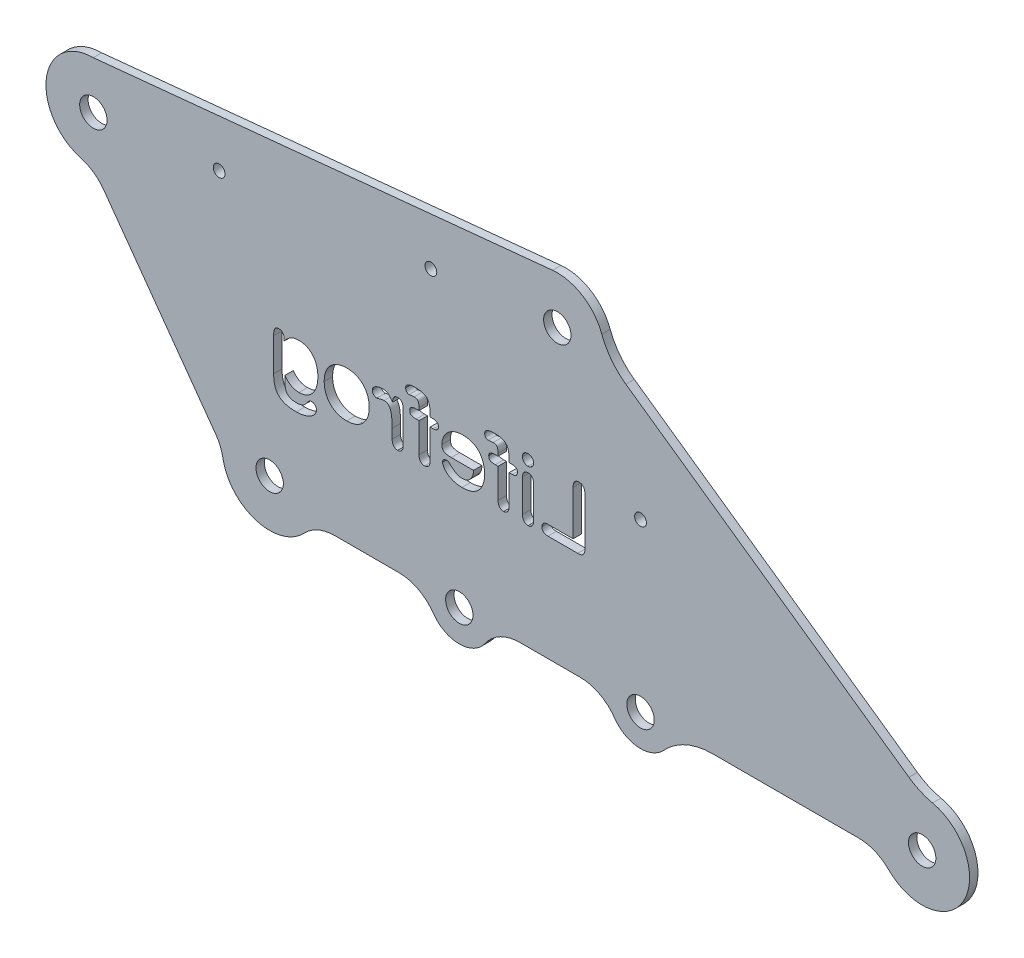
from build123d import *

# Parameters (mm, degrees)
SKETCH2_R           = 3.25
BOSS_EXTRUDE1_DEPTH = 2
SKETCH7_R           = 1.4
CUT_EXTRUDE4_DEPTH  = 170.227847288
CUT_EXTRUDE5_DEPTH  = 170.227847288
SKETCH9_R           = 4.424451358
SKETCH9_R_2         = 3.80051452
CUT_EXTRUDE6_DEPTH  = 10


with BuildPart() as part:
    # Sketch2 → Boss-Extrude1 (new body)
    with BuildSketch(Plane.XY):
        with BuildLine():
            Line((-146.482261324, -3.415116213), (-119.900209046, -40.345357838))
            ThreePointArc((-119.900209046, -40.345357838), (-118.800607084, -42.305283789), (-118.166440512, -44.46126778))
            ThreePointArc((-118.166440512, -44.46126778), (-110.313224995, -53.296457195), (-98.896144571, -50.233151699))
            ThreePointArc((-98.896144571, -50.233151699), (-95.581387, -47.909162096), (-91.616909182, -47.089734824))
            Line((-91.616909182, -47.089734824), (-76.446691, -47.089734824))
            ThreePointArc((-76.446691, -47.089734824), (-71.817590501, -48.22568222), (-68.240172934, -51.37544911))
            ThreePointArc((-68.240172934, -51.37544911), (-62.085284384, -54.589734824), (-55.930395834, -51.37544911))
            ThreePointArc((-55.930395834, -51.37544911), (-52.352978266, -48.22568222), (-47.723877768, -47.089734824))
            Line((-47.723877768, -47.089734824), (-33.446691, -47.089734824))
            ThreePointArc((-33.446691, -47.089734824), (-28.817590501, -48.22568222), (-25.240172934, -51.37544911))
            ThreePointArc((-25.240172934, -51.37544911), (-19.593639667, -54.572486651), (-13.566591065, -52.168516573))
            ThreePointArc((-13.566591065, -52.168516573), (-8.311100334, -48.415273127), (-1.990501675, -47.089734824))
            Line((-1.990501675, -47.089734824), (32.686636747, -47.089734824))
            ThreePointArc((32.686636747, -47.089734824), (36.521461692, -47.854253372), (39.769927676, -50.030911295))
            ThreePointArc((39.769927676, -50.030911295), (57.590414229, -47.521571248), (50.200722675, -31.112458317))
            ThreePointArc((50.200722675, -31.112458317), (47.278407153, -30.14859154), (44.599620096, -28.63430389))
            Line((44.599620096, -28.63430389), (-22.564700668, 18.554547573))
            ThreePointArc((-22.564700668, 18.554547573), (-25.986792869, 21.830620173), (-28.278442139, 25.976908916))
            ThreePointArc((-28.278442139, 25.976908916), (-32.864492812, 31.616465892), (-39.941717654, 33.27458296))
            Line((-39.941717654, 33.27458296), (-148.918739614, 22.469864413))
            ThreePointArc((-148.918739614, 22.469864413), (-160.065949313, 12.737169894), (-151.925623591, 0.379147243))
            ThreePointArc((-151.925623591, 0.379147243), (-148.880072017, -1.053350399), (-146.482261324, -3.415116213))
        make_face()
        with Locations((47.738629971, -42.089734824)):
            Circle(SKETCH2_R, mode=Mode.SUBTRACT)
        with Locations((-19.085284384, -47.089734824)):
            Circle(SKETCH2_R, mode=Mode.SUBTRACT)
        with Locations((-62.085284384, -47.089734824)):
            Circle(SKETCH2_R, mode=Mode.SUBTRACT)
        with Locations((-107.085284384, -42.519495684)):
            Circle(SKETCH2_R, mode=Mode.SUBTRACT)
        with Locations((-148.918739614, 11.219864413)):
            Circle(SKETCH2_R, mode=Mode.SUBTRACT)
        with Locations((-38.831758764, 22.07947281)):
            Circle(SKETCH2_R, mode=Mode.SUBTRACT)
    extrude(amount=BOSS_EXTRUDE1_DEPTH)

    # Sketch7 → Cut-Extrude4 (cut, through all)
    with BuildSketch(Plane.XY.offset(2)):
        with Locations((-119.063647537, 14.164941171)):
            Circle(SKETCH7_R)
        with Locations((-68.831758764, 19.120101507)):
            Circle(SKETCH7_R)
        with Locations((-19.085284384, -7.519495684)):
            Circle(SKETCH7_R)
    extrude(amount=-CUT_EXTRUDE4_DEPTH, mode=Mode.SUBTRACT)

    # Sketch8 → Cut-Extrude5 (cut, through all)
    # profile 1 of 9: a face of its own
    with BuildSketch(Plane(origin=(0, 0, 0), x_dir=(-1, 0, 0), z_dir=(0, 0, -1))):
        with BuildLine():
            Line((35.086320726, -8.88917677), (35.086320726, -19.477067395))
            Line((35.086320726, -19.477067395), (41.039445726, -19.477067395))
            add(Edge.make_bspline(
                [(41.039445726, -19.477067395), (41.151207657, -19.479993195), (41.364330782, -19.485572515), (41.662298188, -19.554542719), (41.923339942, -19.661257744), (42.134401002, -19.819951832), (42.304522289, -20.005566477), (42.428077526, -20.217869304), (42.500347045, -20.454899643), (42.50877144, -20.620129964), (42.513078539, -20.704606457)],
                knots=[0, 0, 0, 0, 1.240270116, 2.365118784, 3.381765818, 4.352609133, 5.275186246, 6.165500839, 7.062084633, 8, 8, 8, 8], degree=3))
            add(Edge.make_bspline(
                [(42.513078539, -20.704606457), (42.508946769, -20.791061883), (42.500954328, -20.958300126), (42.427991131, -21.197153566), (42.305901504, -21.407864411), (42.137936653, -21.589554136), (41.927138947, -21.739731647), (41.667288952, -21.839448431), (41.367976859, -21.905877279), (41.153144472, -21.911559901), (41.039445726, -21.914567395)],
                knots=[0, 0, 0, 0, 0.961785517, 1.860465312, 2.752861249, 3.654173772, 4.599371787, 5.609990076, 6.735101654, 8, 8, 8, 8], degree=3))
            Line((41.039445726, -21.914567395), (33.996476976, -21.914567395))
            add(Edge.make_bspline(
                [(33.996476976, -21.914567395), (33.853353838, -21.910822677), (33.586803908, -21.903848583), (33.219164265, -21.820051925), (32.910084712, -21.691568649), (32.663815683, -21.496286799), (32.482305295, -21.2361672), (32.358100514, -20.915092293), (32.287886266, -20.530846545), (32.278723904, -20.25471837), (32.273820726, -20.106950207)],
                knots=[0, 0, 0, 0, 1.184943227, 2.206816713, 3.109923682, 3.939837529, 4.776053014, 5.71019795, 6.774627611, 8, 8, 8, 8], degree=3))
            Line((32.273820726, -20.106950207), (32.273820726, -8.88917677))
            add(Edge.make_bspline(
                [(32.273820726, -8.88917677), (32.277444522, -8.749162056), (32.284268854, -8.485486372), (32.356957437, -8.118037422), (32.476634418, -7.804802622), (32.645141816, -7.546892469), (32.856855173, -7.348035389), (33.099081612, -7.202614303), (33.373976884, -7.118889739), (33.566226734, -7.107793002), (33.665422289, -7.102067395)],
                knots=[0, 0, 0, 0, 1.312227502, 2.471186598, 3.495416453, 4.440711492, 5.33513045, 6.197779038, 7.0701043, 8, 8, 8, 8], degree=3))
            add(Edge.make_bspline(
                [(33.665422289, -7.102067395), (33.766728298, -7.106162598), (33.963485083, -7.114116312), (34.241681246, -7.204196573), (34.491196095, -7.34317393), (34.705487503, -7.541754535), (34.882515406, -7.795771782), (35.002902616, -8.111096688), (35.076257378, -8.481501141), (35.082815622, -8.747181708), (35.086320726, -8.88917677)],
                knots=[0, 0, 0, 0, 0.937651975, 1.821110013, 2.686129292, 3.571911612, 4.510265029, 5.535848738, 6.683015045, 8, 8, 8, 8], degree=3))
        make_face()
    # profile 2 of 9: a face of its own
    with BuildSketch(Plane(origin=(0, 0, 0), x_dir=(-1, 0, 0), z_dir=(0, 0, -1))):
        with BuildLine():
            Line((47.086320726, -12.74464552), (47.086320726, -20.476090832))
            add(Edge.make_bspline(
                [(47.086320726, -20.476090832), (47.082420593, -20.602435528), (47.075064066, -20.84074997), (47.005182236, -21.174236118), (46.88809835, -21.460321774), (46.722706311, -21.694972614), (46.519526295, -21.876468441), (46.28964053, -22.009165841), (46.031653529, -22.087195916), (45.85149376, -22.097028675), (45.759172289, -22.102067395)],
                knots=[0, 0, 0, 0, 1.279660949, 2.41372764, 3.434282009, 4.393028164, 5.297478756, 6.175532382, 7.06506577, 8, 8, 8, 8], degree=3))
            add(Edge.make_bspline(
                [(45.759172289, -22.102067395), (45.666704772, -22.097531408), (45.487838174, -22.08875712), (45.23365211, -22.004912745), (45.006451484, -21.871389965), (44.811013414, -21.682373157), (44.650959039, -21.445866625), (44.541087672, -21.160395096), (44.473171135, -20.832780478), (44.465421067, -20.599508451), (44.461320726, -20.476090832)],
                knots=[0, 0, 0, 0, 0.944656094, 1.82731652, 2.710883517, 3.62364324, 4.589202842, 5.612771424, 6.736985008, 8, 8, 8, 8], degree=3))
            Line((44.461320726, -20.476090832), (44.461320726, -12.823747082))
            add(Edge.make_bspline(
                [(44.461320726, -12.823747082), (44.4655151, -12.699382119), (44.473445887, -12.464230884), (44.539697696, -12.136087305), (44.650415089, -11.854229206), (44.811202223, -11.625466775), (45.007817757, -11.44586487), (45.234070933, -11.317596829), (45.488859368, -11.241954113), (45.666855774, -11.232151465), (45.759172289, -11.227067395)],
                knots=[0, 0, 0, 0, 1.282601348, 2.425162879, 3.437763456, 4.38569495, 5.284727511, 6.164859808, 7.048218153, 8, 8, 8, 8], degree=3))
            add(Edge.make_bspline(
                [(45.759172289, -11.227067395), (45.851434596, -11.232364163), (46.031201162, -11.242684541), (46.289294531, -11.316791228), (46.519597684, -11.446472242), (46.719799732, -11.624386887), (46.886864263, -11.846010703), (47.003355814, -12.112795725), (47.074726656, -12.416719887), (47.082335115, -12.631916842), (47.086320726, -12.74464552)],
                knots=[0, 0, 0, 0, 0.975882645, 1.901438153, 2.812865763, 3.75006033, 4.717368935, 5.725761173, 6.808663735, 8, 8, 8, 8], degree=3))
        make_face()
    # profile 3 of 9: a face of its own
    with BuildSketch(Plane(origin=(0, 0, 0), x_dir=(-1, 0, 0), z_dir=(0, 0, -1))):
        with BuildLine():
            add(Edge.make_bspline(
                [(45.788469164, -9.914567395), (45.700155278, -9.911112501), (45.527837589, -9.904371326), (45.279123369, -9.837014704), (45.05142568, -9.726888524), (44.844494731, -9.578448802), (44.672494362, -9.386651845), (44.546452039, -9.154497095), (44.472722475, -8.885778489), (44.46522284, -8.695310105), (44.461320726, -8.59620802)],
                knots=[0, 0, 0, 0, 1.006201835, 1.963296869, 2.915511555, 3.880878732, 4.85189213, 5.829536295, 6.870691953, 8, 8, 8, 8], degree=3))
            add(Edge.make_bspline(
                [(44.461320726, -8.59620802), (44.466503012, -8.504891338), (44.476546269, -8.327919822), (44.551669892, -8.073896193), (44.680826892, -7.848246813), (44.854448523, -7.652100465), (45.060826482, -7.494003153), (45.286053439, -7.371969471), (45.53257688, -7.303278473), (45.702130039, -7.29419357), (45.788469164, -7.289567395)],
                knots=[0, 0, 0, 0, 1.057408726, 2.04925565, 3.037480321, 4.047814229, 5.064214746, 6.036169889, 6.999986943, 8, 8, 8, 8], degree=3))
            add(Edge.make_bspline(
                [(45.788469164, -7.289567395), (45.871883282, -7.293289281), (46.035245133, -7.300578386), (46.272968232, -7.365176401), (46.494233713, -7.471719022), (46.696092474, -7.61868617), (46.874547315, -7.801949122), (46.996351464, -8.035133325), (47.076989401, -8.302838261), (47.083100242, -8.494958443), (47.086320726, -8.59620802)],
                knots=[0, 0, 0, 0, 0.967133894, 1.894077239, 2.837452275, 3.803721558, 4.782485793, 5.777084342, 6.828497526, 8, 8, 8, 8], degree=3))
            add(Edge.make_bspline(
                [(47.086320726, -8.59620802), (47.082548229, -8.694407685), (47.075299369, -8.883098506), (46.999769728, -9.148438196), (46.878868744, -9.381879948), (46.705206821, -9.571319036), (46.504492812, -9.722899361), (46.282136483, -9.833786351), (46.041845864, -9.904963009), (45.873933033, -9.911327839), (45.788469164, -9.914567395)],
                knots=[0, 0, 0, 0, 1.133982342, 2.178948973, 3.165031597, 4.149752721, 5.126395816, 6.06160272, 7.013399203, 8, 8, 8, 8], degree=3))
        make_face()
    # profile 4 of 9: a face of its own
    with BuildSketch(Plane(origin=(0, 0, 0), x_dir=(-1, 0, 0), z_dir=(0, 0, -1))):
        with BuildLine():
            Line((49.632219164, -11.414567395), (50.273820726, -11.414567395))
            Line((50.273820726, -11.414567395), (50.273820726, -10.591325207))
            add(Edge.make_bspline(
                [(50.273820726, -10.591325207), (50.277514056, -10.388045332), (50.284509589, -10.00301306), (50.342549558, -9.457909943), (50.436641901, -8.978381027), (50.569332837, -8.557808501), (50.755633772, -8.195572563), (50.996610195, -7.887535194), (51.293777818, -7.633608774), (51.648730133, -7.431434885), (52.067068931, -7.280410479), (52.552532894, -7.174729198), (53.108091552, -7.111487828), (53.502156344, -7.105323868), (53.710344164, -7.102067395)],
                knots=[0, 0, 0, 0, 1.272338929, 2.409936283, 3.426662608, 4.327577154, 5.161578725, 5.96266415, 6.760383261, 7.592994418, 8.506024445, 9.533847079, 10.697110196, 12, 12, 12, 12], degree=3))
            add(Edge.make_bspline(
                [(53.710344164, -7.102067395), (53.895146779, -7.104261268), (54.241413904, -7.108371958), (54.723647309, -7.168286024), (55.135762658, -7.255167266), (55.473032061, -7.391161667), (55.744889456, -7.558653085), (55.937764712, -7.776533401), (56.05427242, -8.037027657), (56.067659952, -8.223910447), (56.074601976, -8.320817395)],
                knots=[0, 0, 0, 0, 1.495564663, 2.802259462, 3.930374803, 4.895312065, 5.735498063, 6.492167842, 7.218122695, 8, 8, 8, 8], degree=3))
            add(Edge.make_bspline(
                [(56.074601976, -8.320817395), (56.07205453, -8.384563693), (56.067042815, -8.509974928), (56.019565864, -8.690669099), (55.937272087, -8.855101057), (55.831089458, -9.002344218), (55.703605103, -9.125761707), (55.560931421, -9.215318606), (55.405925119, -9.272564588), (55.297752865, -9.278650351), (55.242570726, -9.281754895)],
                knots=[0, 0, 0, 0, 1.08569999, 2.135951137, 3.156332465, 4.20565892, 5.218674748, 6.161348951, 7.062045096, 8, 8, 8, 8], degree=3))
            add(Edge.make_bspline(
                [(55.242570726, -9.281754895), (55.211291096, -9.281243662), (55.139763808, -9.280074624), (55.017892004, -9.265550853), (54.867145158, -9.249871502), (54.639618335, -9.213428957), (54.363834674, -9.175272517), (54.14601204, -9.167906783), (54.047258226, -9.164567395)],
                knots=[0, 0, 0, 0, 0.468218035, 1.070676523, 1.83620524, 2.737967929, 4.521099009, 6, 6, 6, 6], degree=3))
            add(Edge.make_bspline(
                [(54.047258226, -9.164567395), (53.935335203, -9.168513751), (53.730509601, -9.175735811), (53.453388449, -9.253609551), (53.236438618, -9.387787922), (53.093840565, -9.587280743), (53.00705741, -9.82836939), (52.94477266, -10.108223991), (52.902635068, -10.432859402), (52.900145328, -10.66441903), (52.898820726, -10.78761427)],
                knots=[0, 0, 0, 0, 1.158634456, 2.120368021, 2.955008234, 3.751380872, 4.611223429, 5.599229928, 6.722733105, 8, 8, 8, 8], degree=3))
            Line((52.898820726, -10.78761427), (52.898820726, -11.414567395))
            Line((52.898820726, -11.414567395), (53.563859789, -11.414567395))
            add(Edge.make_bspline(
                [(53.563859789, -11.414567395), (53.684179087, -11.416649074), (53.910242779, -11.420560268), (54.225792592, -11.467875581), (54.49621768, -11.540251074), (54.718209635, -11.648680399), (54.893566863, -11.789413733), (55.016660753, -11.965226471), (55.094330745, -12.172143548), (55.10125483, -12.32106946), (55.104875414, -12.398942395)],
                knots=[0, 0, 0, 0, 1.396050608, 2.622990337, 3.6962846, 4.634546857, 5.472373731, 6.277878481, 7.09950757, 8, 8, 8, 8], degree=3))
            add(Edge.make_bspline(
                [(55.104875414, -12.398942395), (55.100784732, -12.506003658), (55.0933337, -12.701011923), (55.017531846, -12.965095468), (54.888175636, -13.171513058), (54.692271136, -13.302589493), (54.461307669, -13.37783369), (54.196374468, -13.437731598), (53.892808985, -13.470942071), (53.677213775, -13.474956644), (53.563859789, -13.477067395)],
                knots=[0, 0, 0, 0, 1.171181197, 2.133264703, 2.982673099, 3.781862637, 4.659228062, 5.636037739, 6.757094158, 8, 8, 8, 8], degree=3))
            Line((53.563859789, -13.477067395), (52.898820726, -13.477067395))
            Line((52.898820726, -13.477067395), (52.898820726, -20.49073927))
            add(Edge.make_bspline(
                [(52.898820726, -20.49073927), (52.894890647, -20.614179922), (52.887425469, -20.848655192), (52.816934516, -21.176561155), (52.703366177, -21.461585314), (52.538062875, -21.695052259), (52.335369862, -21.875428653), (52.106713482, -22.010618694), (51.846897908, -22.086940159), (51.664920121, -22.096942211), (51.571672289, -22.102067395)],
                knots=[0, 0, 0, 0, 1.256538349, 2.386792053, 3.399650087, 4.363398215, 5.272567509, 6.146574889, 7.050280375, 8, 8, 8, 8], degree=3))
            add(Edge.make_bspline(
                [(51.571672289, -22.102067395), (51.482224977, -22.09710813), (51.307699782, -22.087431855), (51.057160741, -22.007724342), (50.831657988, -21.876461922), (50.631448396, -21.694722042), (50.469647741, -21.460721404), (50.355528177, -21.176665365), (50.285268804, -20.8486244), (50.277769023, -20.614169302), (50.273820726, -20.49073927)],
                knots=[0, 0, 0, 0, 0.920542794, 1.796117823, 2.680158831, 3.592296685, 4.561321835, 5.585807508, 6.729036556, 8, 8, 8, 8], degree=3))
            Line((50.273820726, -20.49073927), (50.273820726, -13.477067395))
            Line((50.273820726, -13.477067395), (49.532609789, -13.477067395))
            add(Edge.make_bspline(
                [(49.532609789, -13.477067395), (49.437497333, -13.474545828), (49.257144996, -13.469764431), (49.004612129, -13.411306638), (48.782055088, -13.326305771), (48.598641031, -13.197615767), (48.451306666, -13.041843238), (48.352045043, -12.858126156), (48.285842232, -12.656347119), (48.279207657, -12.513757181), (48.275773851, -12.43995802)],
                knots=[0, 0, 0, 0, 1.239726906, 2.350771435, 3.369360947, 4.331849643, 5.252604265, 6.143447782, 7.039118766, 8, 8, 8, 8], degree=3))
            add(Edge.make_bspline(
                [(48.275773851, -12.43995802), (48.278931014, -12.359364997), (48.28493967, -12.205981751), (48.351465421, -11.99217143), (48.459813646, -11.809230275), (48.613188222, -11.659732473), (48.810357544, -11.547566221), (49.047458479, -11.470404208), (49.325403123, -11.419710271), (49.525517403, -11.416355939), (49.632219164, -11.414567395)],
                knots=[0, 0, 0, 0, 0.995382564, 1.894394861, 2.740686784, 3.604514537, 4.515167111, 5.524921804, 6.68027808, 8, 8, 8, 8], degree=3))
        make_face()
    # profile 5 of 9: a face of its own
    with BuildSketch(Plane(origin=(0, 0, 0), x_dir=(-1, 0, 0), z_dir=(0, 0, -1))):
        with BuildLine():
            Line((63.993547289, -17.227067395), (58.711320726, -17.227067395))
            add(Edge.make_bspline(
                [(58.711320726, -17.227067395), (58.716485938, -17.373895282), (58.726607174, -17.661604604), (58.802714884, -18.07799563), (58.915860462, -18.469071713), (59.073647335, -18.829619398), (59.270554735, -19.153364248), (59.492765404, -19.442705533), (59.750507136, -19.684973297), (60.03645821, -19.88267243), (60.345770403, -20.033615445), (60.670482904, -20.148105778), (61.01253608, -20.212156224), (61.245255038, -20.222066531), (61.362687914, -20.227067395)],
                knots=[0, 0, 0, 0, 1.179639705, 2.311504614, 3.392005435, 4.44652888, 5.46432702, 6.431680492, 7.370191764, 8.295643874, 9.215452015, 10.129041871, 11.055891293, 12, 12, 12, 12], degree=3))
            add(Edge.make_bspline(
                [(61.362687914, -20.227067395), (61.517315025, -20.221290078), (61.81522082, -20.210159454), (62.248320892, -20.128402077), (62.65037596, -19.976572402), (63.029981243, -19.770423211), (63.382588562, -19.521193305), (63.667016112, -19.296133613), (63.89432751, -19.094787244), (64.085795058, -18.918875484), (64.304668367, -18.722900775), (64.455732274, -18.581855292), (64.535539476, -18.507340832)],
                knots=[0, 0, 0, 0, 1.247905556, 2.404224554, 3.538983975, 4.702801183, 5.881313568, 7.020008393, 7.628790321, 8.331868978, 9.11872483, 10, 10, 10, 10], degree=3))
            add(Edge.make_bspline(
                [(64.535539476, -18.507340832), (64.572653698, -18.48027204), (64.649909263, -18.423926662), (64.791469612, -18.369543996), (64.954050743, -18.338198915), (65.069560502, -18.333846809), (65.130266039, -18.331559582)],
                knots=[0, 0, 0, 0, 0.868866131, 1.808598965, 2.848320883, 4, 4, 4, 4], degree=3))
            add(Edge.make_bspline(
                [(65.130266039, -18.331559582), (65.197009882, -18.333900139), (65.324294385, -18.33836372), (65.504066974, -18.385198991), (65.666679189, -18.453914722), (65.804779268, -18.559309462), (65.921073021, -18.686697731), (66.001439392, -18.843467551), (66.053282091, -19.021621344), (66.057023071, -19.149522649), (66.058976976, -19.216325207)],
                knots=[0, 0, 0, 0, 1.102465736, 2.102468148, 3.057950005, 4.00546365, 4.956145095, 5.889200524, 6.897534264, 8, 8, 8, 8], degree=3))
            add(Edge.make_bspline(
                [(66.058976976, -19.216325207), (66.055140543, -19.281058441), (66.047007822, -19.418284177), (65.990684139, -19.630580971), (65.89753, -19.856403047), (65.771680317, -20.095129398), (65.612344825, -20.341196211), (65.409653802, -20.580823639), (65.174931597, -20.819411181), (64.902221637, -21.049528185), (64.595344086, -21.269822809), (64.249335099, -21.470546591), (63.864239991, -21.646257285), (63.446257949, -21.809324299), (62.992864569, -21.941257019), (62.504327356, -22.0333954), (61.984342492, -22.094193404), (61.625563625, -22.099400308), (61.441789476, -22.102067395)],
                knots=[0, 0, 0, 0, 0.525537938, 1.114069654, 1.772306998, 2.506549159, 3.302753817, 4.147512317, 5.050313588, 6.017967943, 7.041213872, 8.114344659, 9.260276936, 10.47524946, 11.755151616, 13.087980653, 14.508401902, 16, 16, 16, 16], degree=3))
            add(Edge.make_bspline(
                [(61.441789476, -22.102067395), (61.231648736, -22.097519737), (60.821964685, -22.088653761), (60.226784289, -22.021353682), (59.669210967, -21.908362258), (59.150569744, -21.745772772), (58.667513306, -21.542562166), (58.224053508, -21.288395048), (57.820679107, -20.987522623), (57.455460166, -20.64373407), (57.134442572, -20.257975864), (56.850340149, -19.841633038), (56.616330833, -19.388813691), (56.421842234, -18.905299727), (56.270116103, -18.389217889), (56.162139879, -17.840151988), (56.09676424, -17.258936562), (56.089857706, -16.86005426), (56.086320726, -16.655778332)],
                knots=[0, 0, 0, 0, 1.161895415, 2.265196273, 3.307380836, 4.303185105, 5.266158709, 6.199917451, 7.122316156, 8.043005893, 8.966794753, 9.89246016, 10.824859252, 11.779559524, 12.770652002, 13.794812853, 14.87067777, 16, 16, 16, 16], degree=3))
            add(Edge.make_bspline(
                [(56.086320726, -16.655778332), (56.089863596, -16.462226663), (56.096844531, -16.080848933), (56.163955879, -15.519624607), (56.268451373, -14.979723953), (56.413728423, -14.462108781), (56.604168314, -13.975533109), (56.829293377, -13.519340339), (57.098097208, -13.102077052), (57.402287332, -12.718106315), (57.750981266, -12.376213514), (58.140980683, -12.074737303), (58.573216423, -11.817183613), (59.045085371, -11.603132446), (59.551427203, -11.433045112), (60.089833345, -11.315293392), (60.656383848, -11.238702527), (61.044069017, -11.231007425), (61.242570726, -11.227067395)],
                knots=[0, 0, 0, 0, 1.095507523, 2.15860795, 3.195309999, 4.206995944, 5.197887526, 6.149926361, 7.082497361, 8.003040645, 8.917987058, 9.840388418, 10.787726911, 11.760164811, 12.769081724, 13.806049167, 14.876658106, 16, 16, 16, 16], degree=3))
            add(Edge.make_bspline(
                [(61.242570726, -11.227067395), (61.372538981, -11.22810589), (61.627045231, -11.23013949), (62.001408011, -11.265268194), (62.362503375, -11.313850777), (62.710727077, -11.382379075), (63.04253843, -11.478141357), (63.361054388, -11.589179566), (63.666118712, -11.720379466), (63.955121946, -11.874248291), (64.230989577, -12.038773815), (64.485024674, -12.223475089), (64.726773861, -12.411434191), (64.947774364, -12.616494045), (65.15303199, -12.831425773), (65.33677691, -13.06140635), (65.506460871, -13.299708893), (65.701149201, -13.632045496), (65.90499798, -14.058699678), (66.086744263, -14.582630241), (66.196585792, -15.115069491), (66.210329972, -15.472667779), (66.217180101, -15.65089552)],
                knots=[0, 0, 0, 0, 1.048847282, 2.053872234, 3.03283051, 3.989924751, 4.915857681, 5.818505585, 6.711913066, 7.593554535, 8.460263899, 9.302531452, 10.127499996, 10.930978608, 11.734070318, 12.524563272, 13.305443929, 14.093732096, 15.631266151, 17.114748765, 18.561984696, 20, 20, 20, 20], degree=3))
            add(Edge.make_bspline(
                [(66.217180101, -15.65089552), (66.215610952, -15.730068621), (66.212617901, -15.881086234), (66.186937014, -16.097314554), (66.140772023, -16.291180146), (66.075053252, -16.464024902), (65.995488051, -16.617172785), (65.89278487, -16.74579461), (65.773975455, -16.854326494), (65.582181996, -16.968584464), (65.300769745, -17.07492862), (64.916543956, -17.164445981), (64.474589043, -17.219117531), (64.159728488, -17.224321026), (63.993547289, -17.227067395)],
                knots=[0, 0, 0, 0, 0.899856074, 1.716417764, 2.470354694, 3.159019517, 3.814679391, 4.423252287, 5.02068589, 5.633798556, 6.949059873, 8.421953477, 10.111532063, 12, 12, 12, 12], degree=3))
        make_face()
        with BuildLine():
            Line((58.711320726, -15.727067395), (63.606828539, -15.727067395))
            add(Edge.make_bspline(
                [(63.606828539, -15.727067395), (63.597892017, -15.620388862), (63.580506578, -15.412852503), (63.525243597, -15.113999216), (63.460289426, -14.835108466), (63.374142884, -14.577543089), (63.272543011, -14.341165405), (63.154505162, -14.123236857), (63.017386306, -13.928050969), (62.863841728, -13.753386376), (62.694974951, -13.600302554), (62.514511391, -13.465060191), (62.318539721, -13.352382039), (62.109343802, -13.262997606), (61.88971522, -13.187447347), (61.65522259, -13.140138129), (61.409640164, -13.105158478), (61.240753138, -13.103110926), (61.154680101, -13.102067395)],
                knots=[0, 0, 0, 0, 1.274652096, 2.479755284, 3.617009281, 4.684005428, 5.71065458, 6.679155714, 7.63137599, 8.546404667, 9.444107911, 10.342338794, 11.228430864, 12.129821099, 13.049645363, 13.989847955, 14.975528821, 16, 16, 16, 16], degree=3))
            add(Edge.make_bspline(
                [(61.154680101, -13.102067395), (61.072577515, -13.10475237), (60.911762666, -13.110011447), (60.674960792, -13.138599654), (60.450175128, -13.191199261), (60.236485897, -13.265652746), (60.033877273, -13.359118289), (59.842432731, -13.474146939), (59.662756958, -13.609700616), (59.495375907, -13.766189336), (59.339368932, -13.941320054), (59.201880517, -14.138573533), (59.081832188, -14.355594311), (58.972348183, -14.589561112), (58.881951346, -14.845787112), (58.809840485, -15.122470817), (58.750931011, -15.417941176), (58.724734593, -15.622383021), (58.711320726, -15.727067395)],
                knots=[0, 0, 0, 0, 0.988988761, 1.937138454, 2.867098831, 3.763434994, 4.657917626, 5.549380048, 6.447873833, 7.363218941, 8.304708192, 9.267190604, 10.251834605, 11.288414524, 12.374576878, 13.518478699, 14.729337904, 16, 16, 16, 16], degree=3))
        make_face(mode=Mode.SUBTRACT)
    # profile 6 of 9: a face of its own
    with BuildSketch(Plane(origin=(0, 0, 0), x_dir=(-1, 0, 0), z_dir=(0, 0, -1))):
        with BuildLine():
            Line((68.382219164, -11.414567395), (69.023820726, -11.414567395))
            Line((69.023820726, -11.414567395), (69.023820726, -10.591325207))
            add(Edge.make_bspline(
                [(69.023820726, -10.591325207), (69.027514056, -10.388045332), (69.034509589, -10.00301306), (69.092549558, -9.457909943), (69.186641901, -8.978381027), (69.319332837, -8.557808501), (69.505633772, -8.195572563), (69.746610195, -7.887535194), (70.043777818, -7.633608774), (70.398730133, -7.431434885), (70.817068931, -7.280410479), (71.302532894, -7.174729198), (71.858091552, -7.111487828), (72.252156344, -7.105323868), (72.460344164, -7.102067395)],
                knots=[0, 0, 0, 0, 1.272338929, 2.409936283, 3.426662608, 4.327577154, 5.161578725, 5.96266415, 6.760383261, 7.592994418, 8.506024445, 9.533847079, 10.697110196, 12, 12, 12, 12], degree=3))
            add(Edge.make_bspline(
                [(72.460344164, -7.102067395), (72.645146779, -7.104261268), (72.991413904, -7.108371958), (73.473647309, -7.168286024), (73.885762658, -7.255167266), (74.223032061, -7.391161667), (74.494889456, -7.558653085), (74.687764712, -7.776533401), (74.80427242, -8.037027657), (74.817659952, -8.223910447), (74.824601976, -8.320817395)],
                knots=[0, 0, 0, 0, 1.495564663, 2.802259462, 3.930374803, 4.895312065, 5.735498063, 6.492167842, 7.218122695, 8, 8, 8, 8], degree=3))
            add(Edge.make_bspline(
                [(74.824601976, -8.320817395), (74.82205453, -8.384563693), (74.817042815, -8.509974928), (74.769565864, -8.690669099), (74.687272087, -8.855101057), (74.581089458, -9.002344218), (74.453605103, -9.125761707), (74.310931421, -9.215318606), (74.155925119, -9.272564588), (74.047752865, -9.278650351), (73.992570726, -9.281754895)],
                knots=[0, 0, 0, 0, 1.08569999, 2.135951137, 3.156332465, 4.20565892, 5.218674748, 6.161348951, 7.062045096, 8, 8, 8, 8], degree=3))
            add(Edge.make_bspline(
                [(73.992570726, -9.281754895), (73.961291096, -9.281243662), (73.889763808, -9.280074624), (73.767892004, -9.265550853), (73.617145158, -9.249871502), (73.389618335, -9.213428957), (73.113834674, -9.175272517), (72.89601204, -9.167906783), (72.797258226, -9.164567395)],
                knots=[0, 0, 0, 0, 0.468218035, 1.070676523, 1.83620524, 2.737967929, 4.521099009, 6, 6, 6, 6], degree=3))
            add(Edge.make_bspline(
                [(72.797258226, -9.164567395), (72.685335203, -9.168513751), (72.480509601, -9.175735811), (72.203388449, -9.253609551), (71.986438618, -9.387787922), (71.843840565, -9.587280743), (71.75705741, -9.82836939), (71.69477266, -10.108223991), (71.652635068, -10.432859402), (71.650145328, -10.66441903), (71.648820726, -10.78761427)],
                knots=[0, 0, 0, 0, 1.158634456, 2.120368021, 2.955008234, 3.751380872, 4.611223429, 5.599229928, 6.722733105, 8, 8, 8, 8], degree=3))
            Line((71.648820726, -10.78761427), (71.648820726, -11.414567395))
            Line((71.648820726, -11.414567395), (72.313859789, -11.414567395))
            add(Edge.make_bspline(
                [(72.313859789, -11.414567395), (72.434179087, -11.416649074), (72.660242779, -11.420560268), (72.975792592, -11.467875581), (73.24621768, -11.540251074), (73.468209635, -11.648680399), (73.643566863, -11.789413733), (73.766660753, -11.965226471), (73.844330745, -12.172143548), (73.85125483, -12.32106946), (73.854875414, -12.398942395)],
                knots=[0, 0, 0, 0, 1.396050608, 2.622990337, 3.6962846, 4.634546857, 5.472373731, 6.277878481, 7.09950757, 8, 8, 8, 8], degree=3))
            add(Edge.make_bspline(
                [(73.854875414, -12.398942395), (73.850784732, -12.506003658), (73.8433337, -12.701011923), (73.767531846, -12.965095468), (73.638175636, -13.171513058), (73.442271136, -13.302589493), (73.211307669, -13.37783369), (72.946374468, -13.437731598), (72.642808985, -13.470942071), (72.427213775, -13.474956644), (72.313859789, -13.477067395)],
                knots=[0, 0, 0, 0, 1.171181197, 2.133264703, 2.982673099, 3.781862637, 4.659228062, 5.636037739, 6.757094158, 8, 8, 8, 8], degree=3))
            Line((72.313859789, -13.477067395), (71.648820726, -13.477067395))
            Line((71.648820726, -13.477067395), (71.648820726, -20.49073927))
            add(Edge.make_bspline(
                [(71.648820726, -20.49073927), (71.644890647, -20.614179922), (71.637425469, -20.848655192), (71.566934516, -21.176561155), (71.453366177, -21.461585314), (71.288062875, -21.695052259), (71.085369862, -21.875428653), (70.856713482, -22.010618694), (70.596897908, -22.086940159), (70.414920121, -22.096942211), (70.321672289, -22.102067395)],
                knots=[0, 0, 0, 0, 1.256538349, 2.386792053, 3.399650087, 4.363398215, 5.272567509, 6.146574889, 7.050280375, 8, 8, 8, 8], degree=3))
            add(Edge.make_bspline(
                [(70.321672289, -22.102067395), (70.232224977, -22.09710813), (70.057699782, -22.087431855), (69.807160741, -22.007724342), (69.581657988, -21.876461922), (69.381448396, -21.694722042), (69.219647741, -21.460721404), (69.105528177, -21.176665365), (69.035268804, -20.8486244), (69.027769023, -20.614169302), (69.023820726, -20.49073927)],
                knots=[0, 0, 0, 0, 0.920542794, 1.796117823, 2.680158831, 3.592296685, 4.561321835, 5.585807508, 6.729036556, 8, 8, 8, 8], degree=3))
            Line((69.023820726, -20.49073927), (69.023820726, -13.477067395))
            Line((69.023820726, -13.477067395), (68.282609789, -13.477067395))
            add(Edge.make_bspline(
                [(68.282609789, -13.477067395), (68.187497333, -13.474545828), (68.007144996, -13.469764431), (67.754612129, -13.411306638), (67.532055088, -13.326305771), (67.348641031, -13.197615767), (67.201306666, -13.041843238), (67.102045043, -12.858126156), (67.035842232, -12.656347119), (67.029207657, -12.513757181), (67.025773851, -12.43995802)],
                knots=[0, 0, 0, 0, 1.239726906, 2.350771435, 3.369360947, 4.331849643, 5.252604265, 6.143447782, 7.039118766, 8, 8, 8, 8], degree=3))
            add(Edge.make_bspline(
                [(67.025773851, -12.43995802), (67.028931014, -12.359364997), (67.03493967, -12.205981751), (67.101465421, -11.99217143), (67.209813646, -11.809230275), (67.363188222, -11.659732473), (67.560357544, -11.547566221), (67.797458479, -11.470404208), (68.075403123, -11.419710271), (68.275517403, -11.416355939), (68.382219164, -11.414567395)],
                knots=[0, 0, 0, 0, 0.995382564, 1.894394861, 2.740686784, 3.604514537, 4.515167111, 5.524921804, 6.68027808, 8, 8, 8, 8], degree=3))
        make_face()
    # profile 7 of 9: a face of its own
    with BuildSketch(Plane(origin=(0, 0, 0), x_dir=(-1, 0, 0), z_dir=(0, 0, -1))):
        with BuildLine():
            Line((78.023820726, -18.21730177), (78.023820726, -20.464372082))
            add(Edge.make_bspline(
                [(78.023820726, -20.464372082), (78.019892411, -20.592663462), (78.012477123, -20.83483283), (77.942998305, -21.173173015), (77.826395379, -21.46268977), (77.660008013, -21.697626109), (77.457891862, -21.879946249), (77.226225762, -22.008518529), (76.969273636, -22.08740627), (76.789034454, -22.097099946), (76.696672289, -22.102067395)],
                knots=[0, 0, 0, 0, 1.292414504, 2.439627698, 3.46375878, 4.417332263, 5.316903122, 6.185375834, 7.070109971, 8, 8, 8, 8], degree=3))
            add(Edge.make_bspline(
                [(76.696672289, -22.102067395), (76.605316881, -22.09710505), (76.427986301, -22.087472609), (76.174585021, -22.009227395), (75.950610673, -21.875274697), (75.750230464, -21.695716107), (75.591715438, -21.458957778), (75.476710712, -21.174115576), (75.410996302, -20.840355995), (75.403041563, -20.602368539), (75.398820726, -20.476090832)],
                knots=[0, 0, 0, 0, 0.933294383, 1.81162385, 2.680186499, 3.585258456, 4.541104918, 5.566887721, 6.708974649, 8, 8, 8, 8], degree=3))
            Line((75.398820726, -20.476090832), (75.398820726, -13.028825207))
            add(Edge.make_bspline(
                [(75.398820726, -13.028825207), (75.402484719, -12.887967816), (75.409365917, -12.623429237), (75.466438734, -12.253599122), (75.562647251, -11.937580399), (75.705960969, -11.678454634), (75.886700953, -11.470839169), (76.115388002, -11.325648529), (76.384574397, -11.24325969), (76.575973652, -11.232631094), (76.676164476, -11.227067395)],
                knots=[0, 0, 0, 0, 1.34619872, 2.528241455, 3.567694465, 4.487339067, 5.340335725, 6.171799567, 7.043000931, 8, 8, 8, 8], degree=3))
            add(Edge.make_bspline(
                [(76.676164476, -11.227067395), (76.778250892, -11.23166171), (76.970074096, -11.240294554), (77.23647969, -11.31618665), (77.457457209, -11.448839438), (77.627712083, -11.63900255), (77.758010721, -11.876050227), (77.852605586, -12.159893812), (77.912208923, -12.492418163), (77.927694018, -12.729745798), (77.935930101, -12.855973645)],
                knots=[0, 0, 0, 0, 1.044883286, 1.963364657, 2.807970932, 3.650974255, 4.547373518, 5.563477854, 6.704082887, 8, 8, 8, 8], degree=3))
            add(Edge.make_bspline(
                [(77.935930101, -12.855973645), (78.015060213, -12.728702257), (78.166410553, -12.485273209), (78.414258837, -12.155879517), (78.661252631, -11.872664951), (78.918064986, -11.635812705), (79.199992654, -11.445181426), (79.525823034, -11.317799074), (79.892305657, -11.240889927), (80.150364302, -11.231818927), (80.285539476, -11.227067395)],
                knots=[0, 0, 0, 0, 1.18924255, 2.274636787, 3.268721947, 4.168850259, 5.041860026, 5.953170485, 6.927838526, 8, 8, 8, 8], degree=3))
            add(Edge.make_bspline(
                [(80.285539476, -11.227067395), (80.426467245, -11.232489358), (80.70936151, -11.243373249), (81.129162593, -11.320929872), (81.541294315, -11.453132582), (81.873448057, -11.600397905), (82.12154417, -11.742608322), (82.286513298, -11.857020394), (82.423463313, -11.98382965), (82.540429583, -12.115426572), (82.630091374, -12.257833616), (82.691453181, -12.409798496), (82.732078243, -12.569674136), (82.735800435, -12.679941298), (82.737687914, -12.735856457)],
                knots=[0, 0, 0, 0, 1.609451603, 3.230765888, 4.857137694, 6.544750347, 7.369389467, 8.121503283, 8.832102741, 9.496362917, 10.127778221, 10.743023735, 11.362602371, 12, 12, 12, 12], degree=3))
            add(Edge.make_bspline(
                [(82.737687914, -12.735856457), (82.734447601, -12.813574254), (82.728170407, -12.9641306), (82.658798765, -13.177988977), (82.553564502, -13.372817877), (82.402963372, -13.536083886), (82.232143043, -13.670264449), (82.04869511, -13.768279515), (81.85786951, -13.830801857), (81.727395914, -13.839133704), (81.662492601, -13.843278332)],
                knots=[0, 0, 0, 0, 1.088483127, 2.10862957, 3.128406662, 4.178128692, 5.204900727, 6.16884502, 7.089102868, 8, 8, 8, 8], degree=3))
            add(Edge.make_bspline(
                [(81.662492601, -13.843278332), (81.629178627, -13.840040056), (81.542984296, -13.831661558), (81.39025665, -13.792022204), (81.183740219, -13.737267753), (80.939095726, -13.659990651), (80.677274642, -13.576472525), (80.415801332, -13.523477689), (80.172440405, -13.484406004), (80.015169718, -13.479444147), (79.939836351, -13.477067395)],
                knots=[0, 0, 0, 0, 0.454029574, 1.174725489, 2.136679894, 3.357464208, 4.658256254, 5.865202561, 6.977422421, 8, 8, 8, 8], degree=3))
            add(Edge.make_bspline(
                [(79.939836351, -13.477067395), (79.845889074, -13.48141761), (79.66407233, -13.489836608), (79.402436427, -13.542788927), (79.170931902, -13.646030446), (78.963806071, -13.78176069), (78.785197235, -13.961357491), (78.627437355, -14.175620461), (78.492532222, -14.42885195), (78.379665037, -14.716376161), (78.288170049, -15.037011302), (78.209419115, -15.386257938), (78.144574547, -15.764579045), (78.099652318, -16.17561647), (78.064172897, -16.623081436), (78.042345893, -17.113612554), (78.02739976, -17.649826852), (78.025046467, -18.022954037), (78.023820726, -18.21730177)],
                knots=[0, 0, 0, 0, 0.794050632, 1.536731085, 2.238662641, 2.922771156, 3.616952249, 4.366019506, 5.163320251, 6.033432924, 6.970572952, 7.977209821, 9.05675488, 10.211001348, 11.468820729, 12.84806026, 14.358274693, 16, 16, 16, 16], degree=3))
        make_face()
    # profile 8 of 9: a face of its own
    with BuildSketch(Plane(origin=(0, 0, 0), x_dir=(-1, 0, 0), z_dir=(0, 0, -1))):
        with BuildLine():
            add(Edge.make_bspline(
                [(94.148820726, -16.67042677), (94.144486428, -16.865958198), (94.135962174, -17.250509443), (94.063694953, -17.815248603), (93.947256433, -18.356735194), (93.783210596, -18.872727585), (93.575555832, -19.359535852), (93.326640268, -19.813005753), (93.033540056, -20.230278447), (92.700172687, -20.609939276), (92.32896808, -20.9531364), (91.919659255, -21.251299839), (91.478131715, -21.51184656), (91.000994931, -21.724708392), (90.492501837, -21.896725611), (89.950942693, -22.014013606), (89.380489134, -22.090278252), (88.989896722, -22.098082029), (88.790422289, -22.102067395)],
                knots=[0, 0, 0, 0, 1.091425222, 2.14650367, 3.173246554, 4.180341516, 5.164818684, 6.123963105, 7.063390915, 8.006199165, 8.940071845, 9.880179878, 10.828459563, 11.797350195, 12.792281962, 13.820196984, 14.886780802, 16, 16, 16, 16], degree=3))
            add(Edge.make_bspline(
                [(88.790422289, -22.102067395), (88.591870928, -22.098480665), (88.203960118, -22.091473252), (87.638922615, -22.010038917), (87.101578123, -21.894122427), (86.597818959, -21.719498742), (86.124926323, -21.501305834), (85.684600318, -21.240748892), (85.277774178, -20.936460383), (84.904876516, -20.593622978), (84.569894039, -20.211571465), (84.277056806, -19.794745386), (84.02509942, -19.345794671), (83.821438064, -18.863747925), (83.658781072, -18.352053245), (83.547410974, -17.811904116), (83.473790099, -17.246665517), (83.465530656, -16.861096277), (83.461320726, -16.664567395)],
                knots=[0, 0, 0, 0, 1.111227023, 2.171009928, 3.19145726, 4.186070048, 5.150303806, 6.104321695, 7.046220171, 7.990735544, 8.936485474, 9.886464991, 10.839039205, 11.814379169, 12.812535149, 13.84133354, 14.899703965, 16, 16, 16, 16], degree=3))
            add(Edge.make_bspline(
                [(83.461320726, -16.664567395), (83.465514225, -16.466082785), (83.473742721, -16.076615619), (83.547624747, -15.505610155), (83.658102464, -14.959085186), (83.824393346, -14.441866346), (84.031384338, -13.954809255), (84.28098393, -13.502415749), (84.569020413, -13.085777538), (84.899270526, -12.708353762), (85.269523718, -12.371342104), (85.67658854, -12.072840001), (86.121373859, -11.818014706), (86.60023799, -11.604092229), (87.110125782, -11.43336561), (87.648459537, -11.31556227), (88.211067148, -11.238923762), (88.594851206, -11.231069711), (88.790422289, -11.227067395)],
                knots=[0, 0, 0, 0, 1.109458584, 2.176983352, 3.214831729, 4.223461232, 5.209438476, 6.170044374, 7.10777617, 8.036608407, 8.968213882, 9.902121437, 10.853822319, 11.829170779, 12.830797886, 13.854949514, 14.906911741, 16, 16, 16, 16], degree=3))
            add(Edge.make_bspline(
                [(88.790422289, -11.227067395), (88.988898872, -11.231174927), (89.378472694, -11.239237275), (89.948439143, -11.31420497), (90.490442677, -11.436140384), (91.001366108, -11.60975716), (91.480472692, -11.827861391), (91.928322675, -12.083355331), (92.33525077, -12.389972109), (92.707032955, -12.732556775), (93.044393285, -13.110969179), (93.333369182, -13.530134072), (93.585085083, -13.980402785), (93.789040515, -14.465390299), (93.949727682, -14.979606196), (94.06772993, -15.519473979), (94.135154052, -16.08667861), (94.144198204, -16.472983807), (94.148820726, -16.67042677)],
                knots=[0, 0, 0, 0, 1.106546112, 2.171950929, 3.199928065, 4.200661522, 5.175688508, 6.132331741, 7.070262582, 8.010799296, 8.948477062, 9.891329305, 10.844648531, 11.82089183, 12.82003801, 13.845645933, 14.898896381, 16, 16, 16, 16], degree=3))
        make_face()
        with BuildLine():
            add(Edge.make_bspline(
                [(91.523820726, -16.67042677), (91.52166415, -16.540471396), (91.517472317, -16.287871443), (91.48242374, -15.920543914), (91.422249062, -15.575532262), (91.347241139, -15.250399141), (91.238347477, -14.950063385), (91.115116448, -14.668872274), (90.959772356, -14.413974861), (90.788871248, -14.178150822), (90.594058889, -13.971012519), (90.386177552, -13.786309146), (90.158198426, -13.634549), (89.916762502, -13.505920097), (89.656972659, -13.41067581), (89.382530068, -13.338976081), (89.091429338, -13.298458846), (88.892104067, -13.292570974), (88.790422289, -13.289567395)],
                knots=[0, 0, 0, 0, 1.270558422, 2.469640054, 3.603049319, 4.693866399, 5.726721989, 6.722451407, 7.690273023, 8.639449843, 9.565088081, 10.465156222, 11.352368502, 12.23649231, 13.133922735, 14.051050542, 15.005782631, 16, 16, 16, 16], degree=3))
            add(Edge.make_bspline(
                [(88.790422289, -13.289567395), (88.659103624, -13.293167537), (88.402886757, -13.300191802), (88.031896286, -13.381687907), (87.682368849, -13.501977975), (87.361299048, -13.680841795), (87.069660153, -13.904384313), (86.809174008, -14.175320472), (86.591638168, -14.498289914), (86.405589523, -14.862686984), (86.265324847, -15.26874037), (86.158586264, -15.706832305), (86.097485862, -16.178473495), (86.090114639, -16.503261048), (86.086320726, -16.67042677)],
                knots=[0, 0, 0, 0, 0.966943267, 1.886610523, 2.788820013, 3.685057501, 4.584069546, 5.490925344, 6.443978365, 7.44584051, 8.500680597, 9.604835001, 10.767226511, 12, 12, 12, 12], degree=3))
            add(Edge.make_bspline(
                [(86.086320726, -16.67042677), (86.089975868, -16.835677251), (86.09707534, -17.156647376), (86.160125836, -17.622697678), (86.260583866, -18.057364566), (86.404461982, -18.457425943), (86.584101967, -18.819204405), (86.804143131, -19.136915148), (87.056381643, -19.412930615), (87.347066752, -19.640114593), (87.667609463, -19.820805111), (88.018399206, -19.946385134), (88.395336031, -20.025112761), (88.656230869, -20.034657865), (88.790422289, -20.039567395)],
                knots=[0, 0, 0, 0, 1.221452891, 2.372458373, 3.470695752, 4.514597835, 5.509283355, 6.448751658, 7.363470559, 8.263476682, 9.165479573, 10.07241203, 11.008543944, 12, 12, 12, 12], degree=3))
            add(Edge.make_bspline(
                [(88.790422289, -20.039567395), (88.892104988, -20.036565161), (89.091432064, -20.030679926), (89.382519836, -19.990143766), (89.657009064, -19.918512142), (89.916630477, -19.823021901), (90.159172029, -19.695037632), (90.385237239, -19.539497593), (90.594238165, -19.355423123), (90.788693162, -19.147917518), (90.960812629, -18.911868837), (91.113426664, -18.65546104), (91.239281777, -18.375603349), (91.346578942, -18.076574149), (91.422386771, -17.753673501), (91.482396805, -17.41152253), (91.517390152, -17.048105533), (91.521641272, -16.798429867), (91.523820726, -16.67042677)],
                knots=[0, 0, 0, 0, 0.996858043, 1.954125933, 2.873689662, 3.773503692, 4.659975762, 5.554937906, 6.457396659, 7.385493423, 8.337191288, 9.315813857, 10.305473609, 11.341072498, 12.425486328, 13.552469893, 14.745206377, 16, 16, 16, 16], degree=3))
        make_face(mode=Mode.SUBTRACT)
    # profile 9 of 9: a face of its own
    with BuildSketch(Plane(origin=(0, 0, 0), x_dir=(-1, 0, 0), z_dir=(0, 0, -1))):
        with BuildLine():
            Line((106.148820726, -13.24855177), (106.148820726, -21.073747082))
            add(Edge.make_bspline(
                [(106.148820726, -21.073747082), (106.145578638, -21.289668532), (106.139304115, -21.707548589), (106.087647215, -22.310838809), (105.997312618, -22.867172203), (105.87222542, -23.377416774), (105.710318638, -23.84506679), (105.498897586, -24.267423187), (105.251306447, -24.653258133), (104.95074422, -24.991966607), (104.608489437, -25.293090564), (104.21162859, -25.544239225), (103.771825619, -25.762432035), (103.278649661, -25.935378901), (102.731346807, -26.064718882), (102.126361775, -26.161485854), (101.458368356, -26.21486082), (100.99266219, -26.222879134), (100.749406664, -26.227067395)],
                knots=[0, 0, 0, 0, 1.193077057, 2.309002223, 3.342578962, 4.304588778, 5.20921544, 6.070806415, 6.909010715, 7.734982653, 8.56501699, 9.419735828, 10.32236431, 11.273091887, 12.300564439, 13.426427611, 14.655728113, 16, 16, 16, 16], degree=3))
            add(Edge.make_bspline(
                [(100.749406664, -26.227067395), (100.523599423, -26.22202945), (100.082375219, -26.212185377), (99.439313286, -26.134772632), (98.833121089, -26.009911299), (98.268330391, -25.836151213), (97.756709712, -25.61584198), (97.297156849, -25.373194016), (96.90504392, -25.092286158), (96.573717183, -24.789883295), (96.315558172, -24.464949316), (96.126441952, -24.133851937), (96.006001323, -23.795706697), (95.990460317, -23.565867789), (95.982805101, -23.452653332)],
                knots=[0, 0, 0, 0, 1.351069114, 2.639970243, 3.869855339, 5.051064834, 6.169170093, 7.199517556, 8.154742545, 9.047991741, 9.875849639, 10.626865665, 11.323619059, 12, 12, 12, 12], degree=3))
            add(Edge.make_bspline(
                [(95.982805101, -23.452653332), (95.986362338, -23.370162444), (95.993247098, -23.210507621), (96.057116047, -22.984868315), (96.157368182, -22.781008156), (96.303861587, -22.611745282), (96.470588202, -22.464836911), (96.665111076, -22.367013987), (96.872932257, -22.299769261), (97.018377877, -22.293031512), (97.093156664, -22.289567395)],
                knots=[0, 0, 0, 0, 1.100593589, 2.130114972, 3.111132825, 4.112532503, 5.103922639, 6.06172617, 7.003464206, 8, 8, 8, 8], degree=3))
            add(Edge.make_bspline(
                [(97.093156664, -22.289567395), (97.187212984, -22.297807486), (97.378139595, -22.314534196), (97.648882696, -22.444243677), (97.896424463, -22.652776613), (98.029590187, -22.834019726), (98.100969164, -22.931168957)],
                knots=[0, 0, 0, 0, 0.904802776, 1.836675377, 2.840423108, 4, 4, 4, 4], degree=3))
            add(Edge.make_bspline(
                [(98.100969164, -22.931168957), (98.175137825, -23.022999385), (98.32511679, -23.208692807), (98.550660272, -23.486189079), (98.794314447, -23.746512382), (99.069278385, -23.974281206), (99.395284902, -24.146027838), (99.772091926, -24.269467496), (100.206663136, -24.341146724), (100.515728119, -24.348291041), (100.679094164, -24.352067395)],
                knots=[0, 0, 0, 0, 0.914657093, 1.849559125, 2.770081465, 3.674097889, 4.601683639, 5.60665287, 6.734920882, 8, 8, 8, 8], degree=3))
            add(Edge.make_bspline(
                [(100.679094164, -24.352067395), (100.845352039, -24.349772775), (101.160483048, -24.345423472), (101.601600038, -24.285053864), (101.987484027, -24.198980643), (102.315356429, -24.065654609), (102.590780708, -23.897104225), (102.822544745, -23.700428003), (103.009718901, -23.473887214), (103.146973543, -23.215432589), (103.2490308, -22.942063458), (103.329376819, -22.657754766), (103.384375905, -22.364576568), (103.411886425, -22.110415408), (103.420846671, -21.891048453), (103.434474931, -21.702786676), (103.442908283, -21.489822304), (103.446736788, -21.254357994), (103.457934273, -20.995690136), (103.462185369, -20.713390218), (103.46845611, -20.407737957), (103.47212331, -20.195818841), (103.474016039, -20.086442395)],
                knots=[0, 0, 0, 0, 1.649040383, 3.12564899, 4.411803224, 5.563945921, 6.621369587, 7.604506927, 8.568970364, 9.519051572, 10.494848921, 11.461599492, 12.448362545, 13.452543324, 13.996197049, 14.627512153, 15.326100287, 16.111569937, 16.965155253, 17.896000539, 18.914076333, 20, 20, 20, 20], degree=3))
            add(Edge.make_bspline(
                [(103.474016039, -20.086442395), (103.369286653, -20.228243024), (103.164348005, -20.505724162), (102.817528696, -20.877376), (102.442844477, -21.192720198), (102.044348908, -21.45735916), (101.614316585, -21.66752994), (101.144288907, -21.808776911), (100.637665064, -21.899353304), (100.285949179, -21.909396738), (100.104875414, -21.914567395)],
                knots=[0, 0, 0, 0, 1.055738715, 2.065911711, 3.03769406, 3.983909981, 4.926118454, 5.894140725, 6.915841209, 8, 8, 8, 8], degree=3))
            add(Edge.make_bspline(
                [(100.104875414, -21.914567395), (99.994441226, -21.912166001), (99.776036181, -21.90741678), (99.454056448, -21.874236458), (99.141308415, -21.822584081), (98.840065478, -21.745500132), (98.548288958, -21.6498829), (98.269175954, -21.527797069), (97.999295761, -21.38790609), (97.740990466, -21.225864527), (97.49518965, -21.04571704), (97.267047943, -20.843687043), (97.047384126, -20.630613496), (96.847523825, -20.395110591), (96.656759723, -20.146190033), (96.489652732, -19.874613587), (96.329534366, -19.590507719), (96.137445139, -19.184568503), (95.938137553, -18.639859379), (95.768966666, -17.942277255), (95.669099205, -17.195772906), (95.655707561, -16.682454565), (95.648820726, -16.418473645)],
                knots=[0, 0, 0, 0, 0.833112071, 1.647640849, 2.439835632, 3.222550966, 3.991445903, 4.753817451, 5.518393315, 6.283004681, 7.052252564, 7.814695319, 8.580583639, 9.358986843, 10.142949644, 10.944274693, 11.762261925, 12.602672888, 14.330023006, 16.127783965, 18.00866038, 20, 20, 20, 20], degree=3))
            add(Edge.make_bspline(
                [(95.648820726, -16.418473645), (95.652642272, -16.221051999), (95.660134445, -15.834005236), (95.722041146, -15.269528036), (95.82493923, -14.734584178), (95.966260416, -14.230525635), (96.152476688, -13.76221528), (96.367793789, -13.327108628), (96.624535766, -12.933618383), (96.912501305, -12.577509314), (97.229367893, -12.259884554), (97.572416193, -11.984063386), (97.938958298, -11.750329511), (98.328110609, -11.559102539), (98.73859142, -11.409212488), (99.170060443, -11.304717183), (99.62033266, -11.237447396), (99.927871945, -11.230568047), (100.084367601, -11.227067395)],
                knots=[0, 0, 0, 0, 1.233131348, 2.417564159, 3.54229185, 4.633406881, 5.682503965, 6.686568855, 7.661289661, 8.611256522, 9.54308529, 10.458735841, 11.355741272, 12.253410383, 13.162451714, 14.079868853, 15.022914474, 16, 16, 16, 16], degree=3))
            add(Edge.make_bspline(
                [(100.084367601, -11.227067395), (100.269315783, -11.232430291), (100.627605237, -11.242819521), (101.14571427, -11.330564927), (101.62709314, -11.467956721), (102.071592609, -11.673662781), (102.49184011, -11.934169427), (102.886423171, -12.266181645), (103.275177029, -12.652319523), (103.504732301, -12.950707472), (103.623430101, -13.104997082)],
                knots=[0, 0, 0, 0, 1.061471399, 2.056327376, 3.009310916, 3.92787468, 4.860034948, 5.84023928, 6.88323694, 8, 8, 8, 8], degree=3))
            Line((103.623430101, -13.104997082), (103.623430101, -12.727067395))
            add(Edge.make_bspline(
                [(103.623430101, -12.727067395), (103.626077546, -12.612313503), (103.631086744, -12.39518899), (103.702722773, -12.091704756), (103.804214345, -11.823343153), (103.960484058, -11.603122273), (104.14437401, -11.422724439), (104.362000974, -11.298828456), (104.601104557, -11.2172405), (104.770200341, -11.210177814), (104.856828539, -11.206559582)],
                knots=[0, 0, 0, 0, 1.247113373, 2.359648813, 3.381150232, 4.352198038, 5.277883478, 6.164782314, 7.059813345, 8, 8, 8, 8], degree=3))
            add(Edge.make_bspline(
                [(104.856828539, -11.206559582), (104.919398777, -11.208373393), (105.039147367, -11.211844711), (105.210376067, -11.234486995), (105.36533458, -11.275276426), (105.503505909, -11.334986164), (105.628592504, -11.406301328), (105.733159003, -11.500628587), (105.821383334, -11.609854306), (105.921728419, -11.781388496), (106.018246955, -12.037350669), (106.092298497, -12.391051336), (106.143763737, -12.800784613), (106.147065006, -13.093092856), (106.148820726, -13.24855177)],
                knots=[0, 0, 0, 0, 0.810834708, 1.551797084, 2.233311032, 2.879728062, 3.498290899, 4.08998989, 4.69281731, 5.311380147, 6.657976162, 8.214589908, 9.986797312, 12, 12, 12, 12], degree=3))
        make_face()
        with BuildLine():
            add(Edge.make_bspline(
                [(98.273820726, -16.60011427), (98.276281556, -16.730047424), (98.281044662, -16.981542019), (98.311655202, -17.347157431), (98.371202048, -17.687645794), (98.450150989, -18.004929454), (98.547119724, -18.300245722), (98.675739383, -18.567527012), (98.820568795, -18.813380932), (98.992902259, -19.030162026), (99.179733998, -19.224261018), (99.38263556, -19.39178449), (99.598998975, -19.533652284), (99.826862156, -19.652126541), (100.070798561, -19.739771747), (100.326009704, -19.803317962), (100.594578391, -19.847388265), (100.778520871, -19.850485666), (100.872453539, -19.852067395)],
                knots=[0, 0, 0, 0, 1.326094944, 2.566748344, 3.739876858, 4.849345108, 5.901987623, 6.905057934, 7.870744796, 8.807773266, 9.724007253, 10.615962186, 11.486673695, 12.360289196, 13.23048723, 14.124833094, 15.042421136, 16, 16, 16, 16], degree=3))
            add(Edge.make_bspline(
                [(100.872453539, -19.852067395), (100.985032624, -19.847129074), (101.208121653, -19.837343196), (101.538167817, -19.771823755), (101.855789615, -19.657505667), (102.165191225, -19.506408219), (102.456515281, -19.30739563), (102.717453893, -19.057934673), (102.952234205, -18.767251673), (103.153003373, -18.431775293), (103.321674171, -18.056411203), (103.44102281, -17.639385406), (103.511456952, -17.184551742), (103.5196042, -16.868929928), (103.523820726, -16.70558302)],
                knots=[0, 0, 0, 0, 0.880139046, 1.744101618, 2.618226241, 3.512817375, 4.4298041, 5.364171231, 6.325232906, 7.342628693, 8.412418537, 9.533532234, 10.723504319, 12, 12, 12, 12], degree=3))
            add(Edge.make_bspline(
                [(103.523820726, -16.70558302), (103.521828321, -16.574619906), (103.51795482, -16.320010232), (103.480555454, -15.949396994), (103.428266274, -15.599848439), (103.34454788, -15.274242485), (103.242674803, -14.969779321), (103.117084696, -14.687598477), (102.96639128, -14.427670741), (102.794428526, -14.191099969), (102.603265332, -13.979670779), (102.398200725, -13.793594575), (102.177028797, -13.636814471), (101.940229913, -13.510556864), (101.690148219, -13.409665), (101.424446708, -13.339618452), (101.144261723, -13.298302832), (100.95267204, -13.292519491), (100.854875414, -13.289567395)],
                knots=[0, 0, 0, 0, 1.287342111, 2.502763926, 3.659965425, 4.759260504, 5.803888242, 6.814004777, 7.790704397, 8.75299419, 9.684461259, 10.588804087, 11.470690333, 12.342850852, 13.221961806, 14.116410723, 15.038525076, 16, 16, 16, 16], degree=3))
            add(Edge.make_bspline(
                [(100.854875414, -13.289567395), (100.75906062, -13.292745672), (100.57252169, -13.298933364), (100.299044703, -13.336677114), (100.041672484, -13.404122728), (99.797230326, -13.498478753), (99.569794689, -13.623115163), (99.352581126, -13.768628456), (99.156446251, -13.948574788), (98.971547222, -14.148675551), (98.807371777, -14.376306837), (98.662718633, -14.626037727), (98.543523384, -14.900966402), (98.443532422, -15.196719787), (98.368464523, -15.515739785), (98.312405714, -15.856255426), (98.280922216, -16.220616918), (98.276234024, -16.471149791), (98.273820726, -16.60011427)],
                knots=[0, 0, 0, 0, 0.970855453, 1.890129187, 2.790031759, 3.660912701, 4.537395663, 5.412817, 6.302655923, 7.22707969, 8.169073145, 9.139777347, 10.145351592, 11.199728276, 12.298788678, 13.461764965, 14.693416344, 16, 16, 16, 16], degree=3))
        make_face(mode=Mode.SUBTRACT)
    extrude(amount=-CUT_EXTRUDE5_DEPTH, mode=Mode.SUBTRACT)


with BuildPart() as cut_extrude5_piece_1:
    # of the separate pieces the step leaves, piece 1, a body of its own (cut_extrude5_pieces)
    add(part.part.solids().sort_by_distance((39.769927676, -50.030911295, 0))[0])


with BuildPart() as cut_extrude5_piece_2:
    # of the separate pieces the step leaves, piece 2, a body of its own (cut_extrude5_pieces)
    add(part.part.solids().sort_by_distance((-91.523820726, -16.67042677, 0))[0])


with BuildPart() as cut_extrude5_piece_3:
    # of the separate pieces the step leaves, piece 3, a body of its own (cut_extrude5_pieces)
    add(part.part.solids().sort_by_distance((-98.273820726, -16.60011427, 0))[0])


with BuildPart() as cut_extrude5_piece_4:
    # of the separate pieces the step leaves, piece 4, a body of its own (cut_extrude5_pieces)
    add(part.part.solids().sort_by_distance((-58.711320726, -15.727067395, 0))[0])


with BuildPart() as cut_extrude6_tool:
    # Sketch9 → Cut-Extrude6 (new body)
    with BuildSketch(Plane(origin=(0, 0, 0), x_dir=(-1, 0, 0), z_dir=(0, 0, -1))):
        with Locations((88.409734629, -16.636264673)):
            Circle(SKETCH9_R)
        with Locations((101.376970507, -16.636264673)):
            Circle(SKETCH9_R_2)
        with BuildLine():
            Line((59.461544017, -12.767168548), (62.400311721, -12.767168548))
            ThreePointArc((62.400311721, -12.767168548), (64.334859784, -14.701716611), (62.400311721, -16.636264673))
            Line((62.400311721, -16.636264673), (59.461544017, -16.636264673))
            ThreePointArc((59.461544017, -16.636264673), (57.526995954, -14.701716611), (59.461544017, -12.767168548))
        make_face()
    extrude(amount=-CUT_EXTRUDE6_DEPTH)


with BuildPart() as cut_extrude5_piece_2_1:
    add(cut_extrude5_piece_2.part)

    # Cut-Extrude6: cut by cut_extrude6_tool
    add(cut_extrude6_tool.part, mode=Mode.SUBTRACT)


with BuildPart() as cut_extrude5_piece_3_1:
    add(cut_extrude5_piece_3.part)

    # Cut-Extrude6: cut by cut_extrude6_tool
    add(cut_extrude6_tool.part, mode=Mode.SUBTRACT)


with BuildPart() as cut_extrude5_piece_4_1:
    add(cut_extrude5_piece_4.part)

    # Cut-Extrude6: cut by cut_extrude6_tool
    add(cut_extrude6_tool.part, mode=Mode.SUBTRACT)


solid = cut_extrude5_piece_1.part
